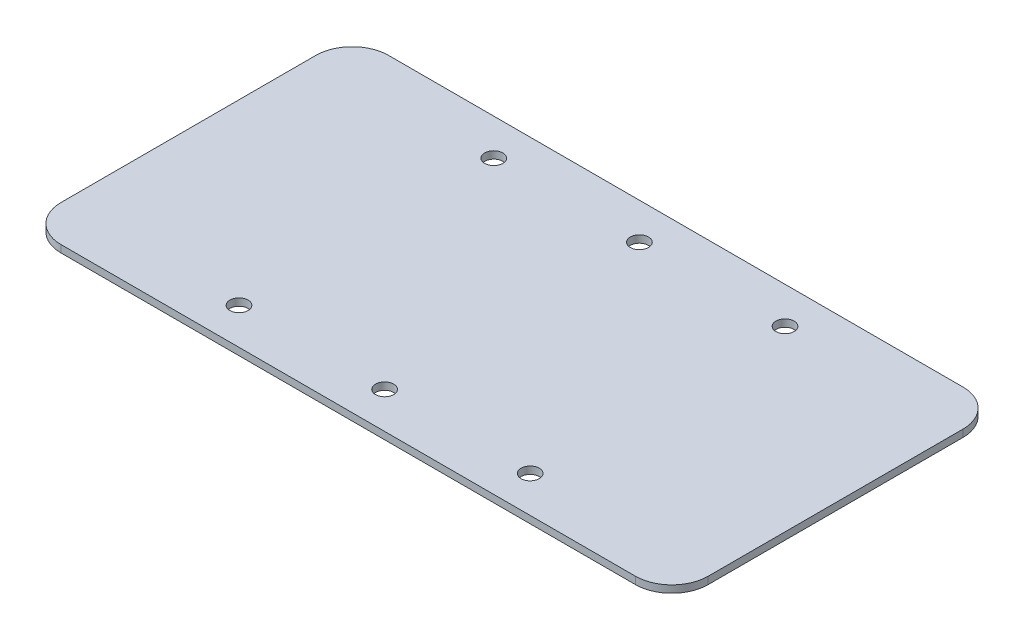
from build123d import *

# Parameters (mm, degrees)
SKETCH1_W           = 177.8
SKETCH1_H           = 90
BOSS_EXTRUDE1_DEPTH = 2
FILLET1_R           = 10


with BuildPart() as part:
    # Sketch1 → Boss-Extrude1 (new body)
    with BuildSketch(Plane(origin=(0, 0, 0), x_dir=(1, 0, 0), z_dir=(0, 1, 0))):
        Rectangle(SKETCH1_W, SKETCH1_H)
        with BuildLine():
            ThreePointArc((-37.5, -35), (-41.767766953, -36.767766953), (-40, -32.5))
            ThreePointArc((-40, -32.5), (-38.232233047, -33.232233047), (-37.5, -35))
        make_face(mode=Mode.SUBTRACT)
        with BuildLine():
            ThreePointArc((2.5, -35), (-1.767766953, -36.767766953), (0, -32.5))
            ThreePointArc((0, -32.5), (1.767766953, -33.232233047), (2.5, -35))
        make_face(mode=Mode.SUBTRACT)
        with BuildLine():
            ThreePointArc((42.5, -35), (38.232233047, -36.767766953), (40, -32.5))
            ThreePointArc((40, -32.5), (41.767766953, -33.232233047), (42.5, -35))
        make_face(mode=Mode.SUBTRACT)
        with BuildLine():
            ThreePointArc((-37.5, 35), (-38.232233047, 33.232233047), (-40, 32.5))
            ThreePointArc((-40, 32.5), (-41.767766953, 36.767766953), (-37.5, 35))
        make_face(mode=Mode.SUBTRACT)
        with BuildLine():
            ThreePointArc((2.5, 35), (1.767766953, 33.232233047), (0, 32.5))
            ThreePointArc((0, 32.5), (-1.767766953, 36.767766953), (2.5, 35))
        make_face(mode=Mode.SUBTRACT)
        with BuildLine():
            ThreePointArc((42.5, 35), (41.767766953, 33.232233047), (40, 32.5))
            ThreePointArc((40, 32.5), (38.232233047, 36.767766953), (42.5, 35))
        make_face(mode=Mode.SUBTRACT)
    extrude(amount=BOSS_EXTRUDE1_DEPTH)

    # Fillet1
    fillet1_edges = [part.edges().sort_by_distance(p)[0] for p in [
        (88.9, 1, 45),
        (88.9, 1, -45),
        (-88.9, 1, -45),
        (-88.9, 1, 45),
    ]]
    fillet(fillet1_edges, radius=FILLET1_R)


solid = part.part
